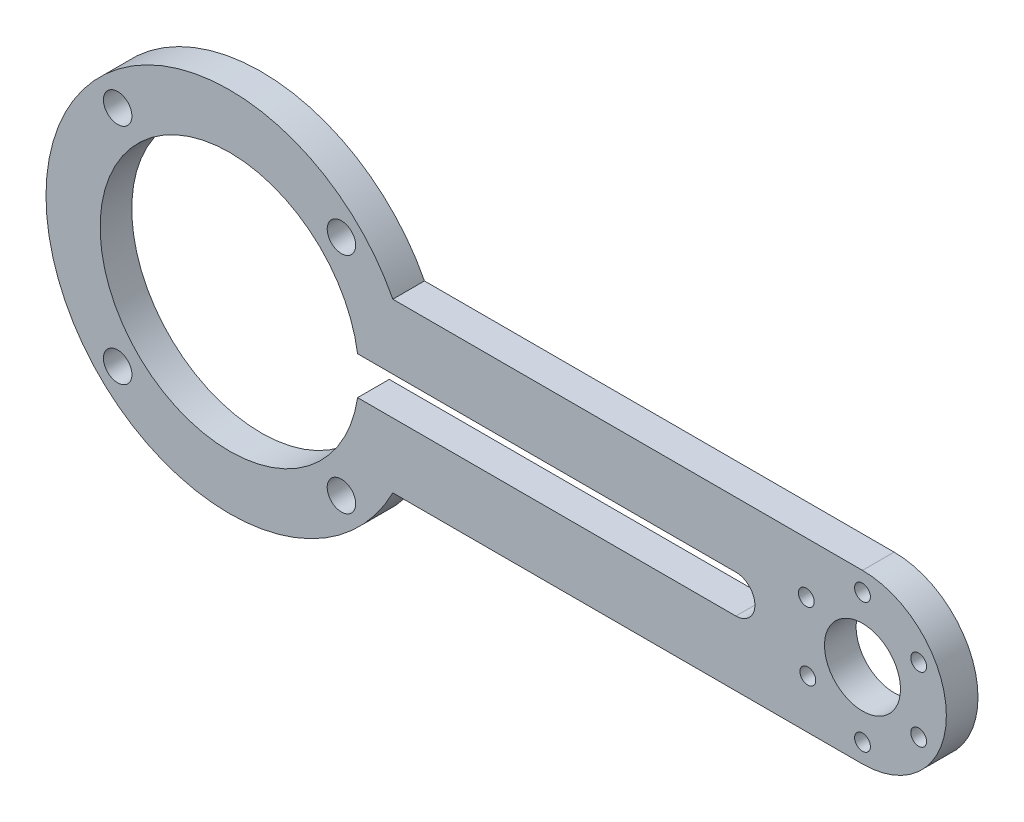
from build123d import *

# Parameters (mm, degrees)
SKETCH2_R           = 6
BOSS_EXTRUDE1_DEPTH = 5
SKETCH3_R           = 2.25
SKETCH3_R_2         = 1.25
CUT_EXTRUDE1_DEPTH  = 118.010950342


with BuildPart() as part:
    # Sketch2 → Boss-Extrude1 (new body)
    with BuildSketch(Plane.XY):
        with BuildLine():
            ThreePointArc((25.796075283, 13.25), (-29, 0), (25.796075283, -13.25))
            Line((25.796075283, -13.25), (100, -13.25))
            ThreePointArc((100, -13.25), (113.25, 0), (100, 13.25))
            Line((100, 13.25), (25.796075283, 13.25))
        make_face()
        with BuildLine():
            Line((20.228754287, 3), (80, 3))
            ThreePointArc((80, 3), (83, 0), (80, -3))
            Line((80, -3), (20.228754287, -3))
            ThreePointArc((20.228754287, -3), (-20.45, 0), (20.228754287, 3))
        make_face(mode=Mode.SUBTRACT)
        with Locations((100, 0)):
            Circle(SKETCH2_R, mode=Mode.SUBTRACT)
    extrude(amount=BOSS_EXTRUDE1_DEPTH)

    # Sketch3 → Cut-Extrude1 (cut, through all)
    with BuildSketch(Plane.XY.offset(5)):
        with Locations((17.67766953, 17.67766953)):
            Circle(SKETCH3_R)
        with Locations((17.67766953, -17.67766953)):
            Circle(SKETCH3_R)
        with Locations((-17.67766953, -17.67766953)):
            Circle(SKETCH3_R)
        with Locations((-17.67766953, 17.67766953)):
            Circle(SKETCH3_R)
        with Locations((100, 10.25)):
            Circle(SKETCH3_R_2)
        with Locations((108.876760389, 5.125)):
            Circle(SKETCH3_R_2)
        with Locations((91.123239611, 5.125)):
            Circle(SKETCH3_R_2)
        with Locations((91.362305232, -5.518399142)):
            Circle(SKETCH3_R_2)
        with Locations((108.876760389, -5.125)):
            Circle(SKETCH3_R_2)
        with Locations((100, -10.25)):
            Circle(SKETCH3_R_2)
    extrude(amount=-CUT_EXTRUDE1_DEPTH, mode=Mode.SUBTRACT)


solid = part.part
